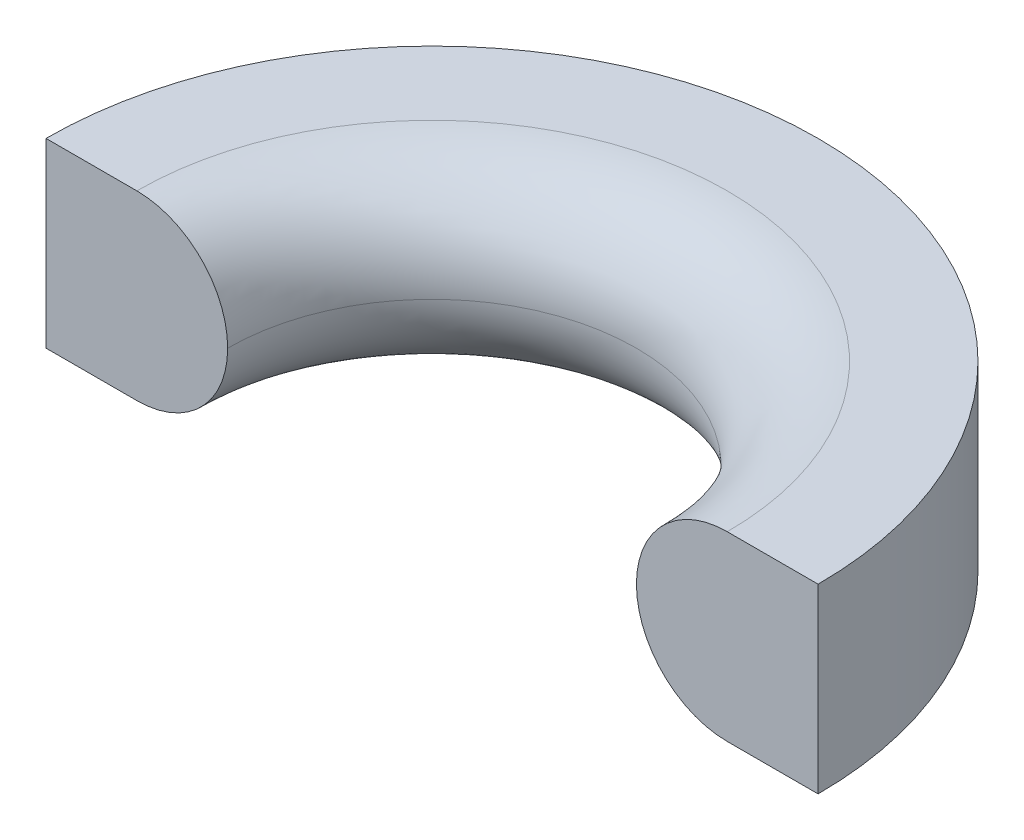
from build123d import *

# Parameters (mm, degrees)
BOSS_EXTRUDE1_DEPTH = 2
FILLET1_R           = 1


with BuildPart() as part:
    # Sketch1 → Boss-Extrude1 (new body)
    with BuildSketch(Plane(origin=(0, 0, 0), x_dir=(1, 0, 0), z_dir=(0, 1, 0))):
        with BuildLine():
            Line((-4.25, 0), (-2.25, 0))
            ThreePointArc((-2.25, 0), (0, 2.25), (2.25, 0))
            Line((2.25, 0), (4.25, 0))
            ThreePointArc((4.25, 0), (0, 4.25), (-4.25, 0))
        make_face()
    extrude(amount=BOSS_EXTRUDE1_DEPTH)

    # Fillet1
    fillet1_edges = [part.edges().sort_by_distance(p)[0] for p in [
        (0, 0, -2.25),
        (0, 2, -2.25),
    ]]
    fillet(fillet1_edges, radius=FILLET1_R - 0.0001)  # a hair under: the kernel refuses the full size


solid = part.part
